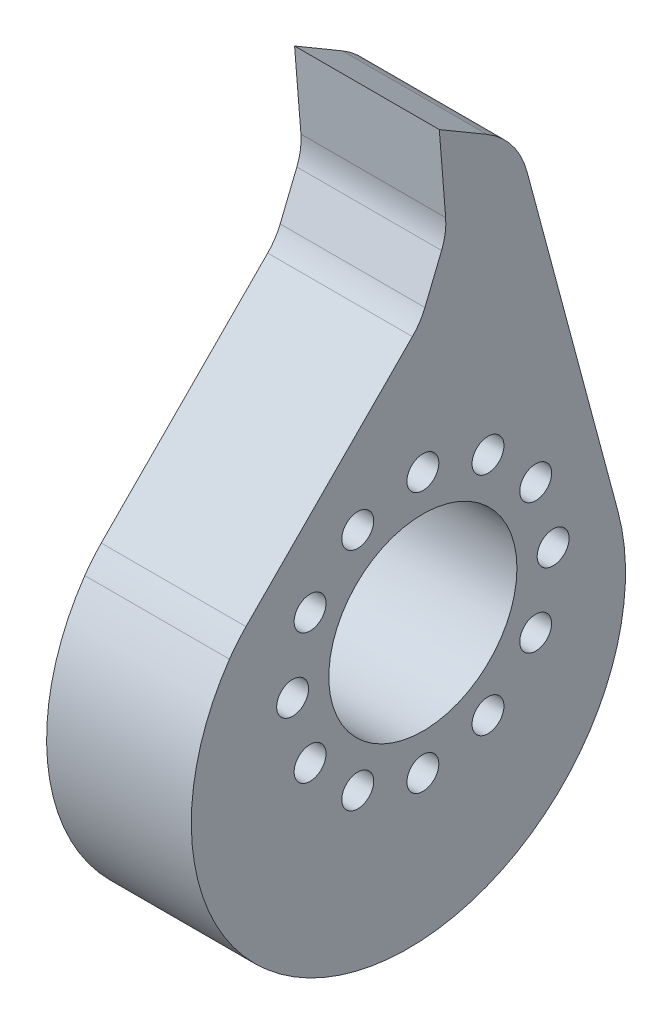
from build123d import *

# Parameters (mm, degrees)
BOSS_EXTRUDE1_DEPTH = 12.7
FILLET1_R           = 7.62
FILLET2_R           = 5.08
FILLET3_R           = 5.08
FILLET4_R           = 12.7
SKETCH2_R           = 8.255
CUT_EXTRUDE1_DEPTH  = 48.683586357
SKETCH3_R           = 1.4
CUT_EXTRUDE2_DEPTH  = 48.683586357


with BuildPart() as part:
    # Sketch1 → Boss-Extrude1 (new body)
    with BuildSketch(Plane(origin=(0, 0, 0), x_dir=(0, 0, -1), z_dir=(1, 0, 0))):
        with BuildLine():
            Line((1.066922574, 27.993915583), (-14.840673001, 11.943907438))
            ThreePointArc((-14.840673001, 11.943907438), (-3.934750082, -18.639212478), (18.401997147, 4.926357784))
            Line((18.401997147, 4.926357784), (9.60791677, 37.775908935))
            Line((9.60791677, 37.775908935), (2.709421458, 41.827406182))
            Line((2.709421458, 41.827406182), (3.366421011, 33.651411738))
            Line((3.366421011, 33.651411738), (1.066922574, 27.993915583))
        make_face()
    extrude(amount=BOSS_EXTRUDE1_DEPTH)

    # Fillet1
    fillet1_edges = [part.edges().sort_by_distance(p)[0] for p in [
        (6.35, 37.775908935, -9.60791677),
    ]]
    fillet(fillet1_edges, radius=FILLET1_R)

    # Fillet2
    fillet2_edges = [part.edges().sort_by_distance(p)[0] for p in [
        (6.35, 27.993915583, -1.066922574),
    ]]
    fillet(fillet2_edges, radius=FILLET2_R)

    # Fillet3
    fillet3_edges = [part.edges().sort_by_distance(p)[0] for p in [
        (6.35, 33.651411738, -3.366421011),
    ]]
    fillet(fillet3_edges, radius=FILLET3_R)

    # Fillet4
    fillet4_edges = [part.edges().sort_by_distance(p)[0] for p in [
        (6.35, 11.943907438, 14.840673001),
    ]]
    fillet(fillet4_edges, radius=FILLET4_R)

    # Sketch2 → Cut-Extrude1 (cut, through all)
    with BuildSketch(Plane(origin=(12.7, 0, 0), x_dir=(0, 0, -1), z_dir=(1, 0, 0))):
        with Locations((1.27, 5.08)):
            Circle(SKETCH2_R)
    extrude(amount=-CUT_EXTRUDE1_DEPTH, mode=Mode.SUBTRACT)

    # Sketch3 → Cut-Extrude2 (cut, through all)
    with BuildSketch(Plane(origin=(12.7, 0, 0), x_dir=(0, 0, -1), z_dir=(1, 0, 0))):
        with Locations((1.27, 16.51)):
            Circle(SKETCH3_R)
        with Locations((6.985, 14.978670365)):
            Circle(SKETCH3_R)
        with Locations((11.168670365, 10.795)):
            Circle(SKETCH3_R)
        with Locations((12.7, 5.08)):
            Circle(SKETCH3_R)
        with Locations((11.168670365, -0.635)):
            Circle(SKETCH3_R)
        with Locations((6.985, -4.818670365)):
            Circle(SKETCH3_R)
        with Locations((1.27, -6.35)):
            Circle(SKETCH3_R)
        with Locations((-4.445, -4.818670365)):
            Circle(SKETCH3_R)
        with Locations((-8.628670365, -0.635)):
            Circle(SKETCH3_R)
        with Locations((-10.16, 5.08)):
            Circle(SKETCH3_R)
        with Locations((-8.628670365, 10.795)):
            Circle(SKETCH3_R)
        with Locations((-4.445, 14.978670365)):
            Circle(SKETCH3_R)
    extrude(amount=-CUT_EXTRUDE2_DEPTH, mode=Mode.SUBTRACT)


solid = part.part
